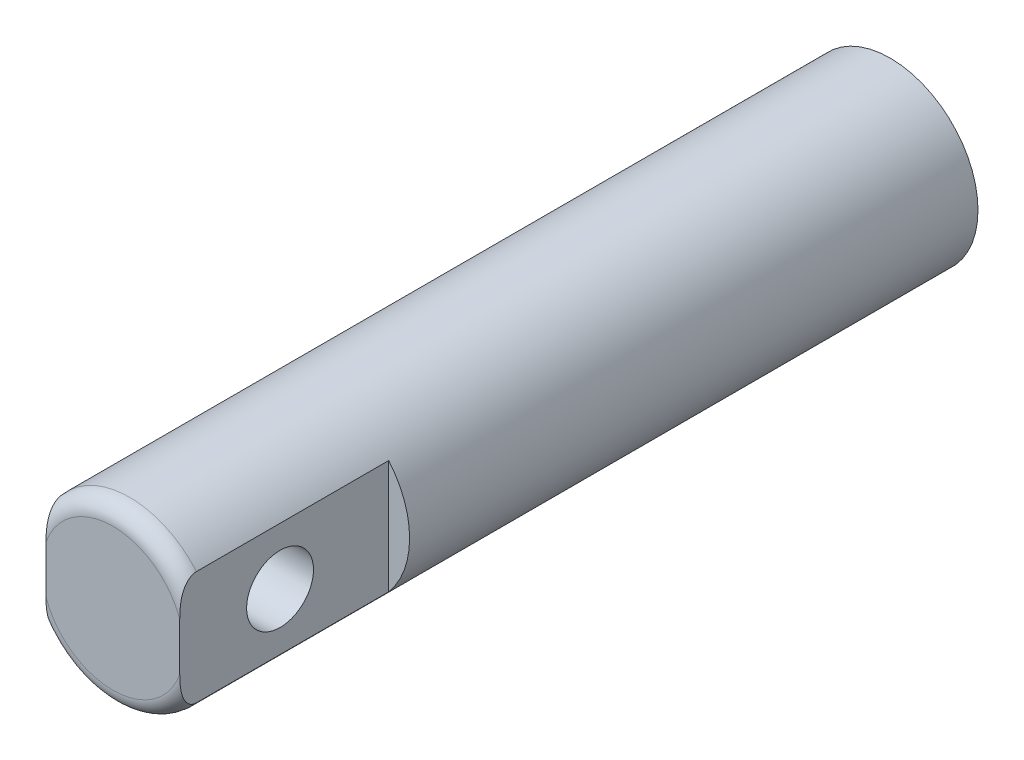
from build123d import *

# Parameters (mm, degrees)
SKETCH_1_R          = 10.5
EXTRUDE_1_DEPTH     = 93
SKETCH_2_R          = 5.25
CUT_EXTRUDE_2_DEPTH = 70
FILLET_1_R          = 2
SKETCH_3_W          = 11
SKETCH_3_H          = 25
CUT_EXTRUDE_3_DEPTH = 15
SKETCH_4_R          = 4
CUT_EXTRUDE_4_DEPTH = 15


with BuildPart() as part:
    # Эскиз1 → Вытянуть1 (new body)
    with BuildSketch(Plane.XY):
        Circle(SKETCH_1_R)
    extrude(amount=EXTRUDE_1_DEPTH)

    # Эскиз2 → Вытянуть2 (cut)
    with BuildSketch(Plane(origin=(0, 0, 0), x_dir=(-1, 0, 0), z_dir=(0, 0, -1))):
        Circle(SKETCH_2_R)
    extrude(amount=-CUT_EXTRUDE_2_DEPTH, mode=Mode.SUBTRACT)

    # Скругление1
    fillet_1_edges = [part.edges().sort_by_distance(p)[0] for p in [
        (-10.5, 0, 93),
    ]]
    fillet(fillet_1_edges, radius=FILLET_1_R)

    # Эскиз3 → Вытянуть3 (cut, symmetric)
    with BuildSketch(Plane(origin=(0, 0, 0), x_dir=(1, 0, 0), z_dir=(0, 1, 0))):
        with Locations((-13.5, -80.5)):
            Rectangle(SKETCH_3_W, SKETCH_3_H)
        with Locations((13.5, -80.5)):
            Rectangle(SKETCH_3_W, SKETCH_3_H)
    extrude(amount=CUT_EXTRUDE_3_DEPTH, both=True, mode=Mode.SUBTRACT)

    # Эскиз4 → Вытянуть4 (cut, symmetric)
    with BuildSketch(Plane(origin=(0, 0, 0), x_dir=(0, 0, -1), z_dir=(1, 0, 0))):
        with Locations((-81, 0)):
            Circle(SKETCH_4_R)
    extrude(amount=CUT_EXTRUDE_4_DEPTH, both=True, mode=Mode.SUBTRACT)


solid = part.part
